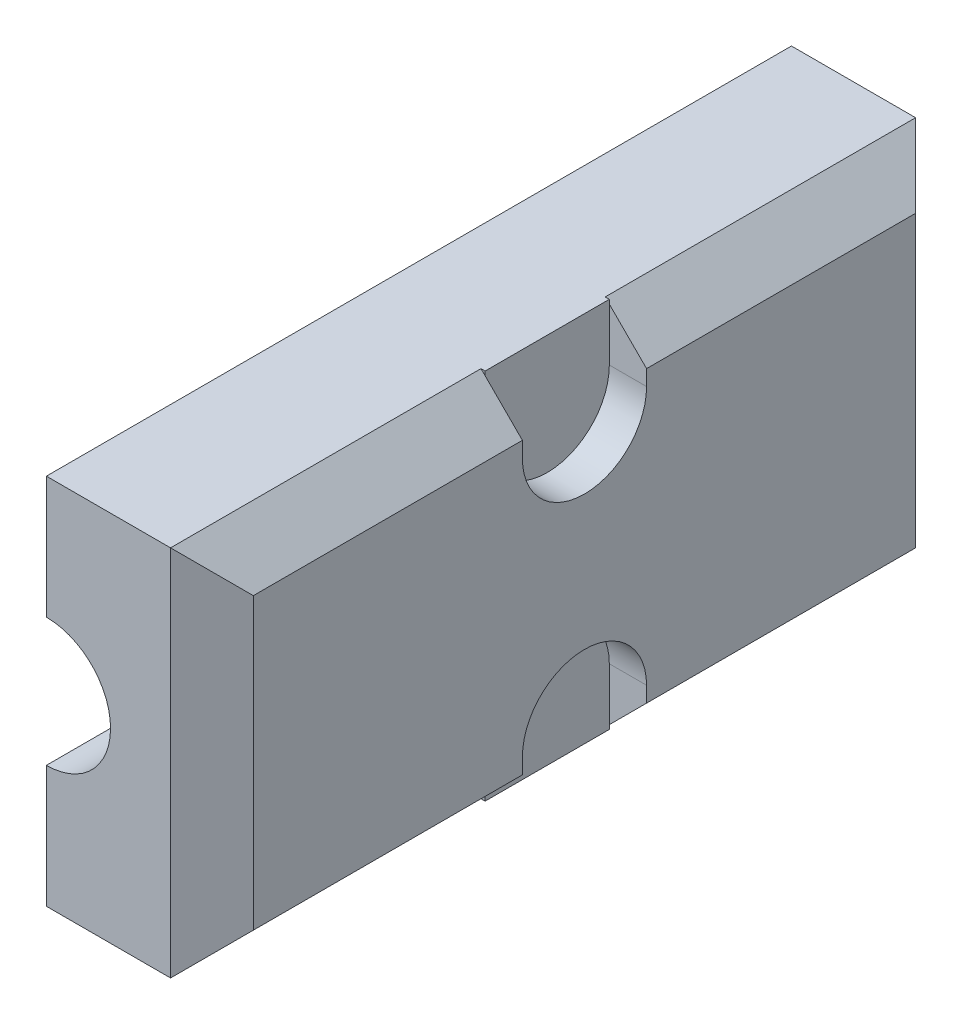
from build123d import *

# Parameters (mm, degrees)
SKETCH_1_W              = 36
SKETCH_1_H              = 18
EXTRUDE_1_DEPTH         = 8
CUT_EXTRUDE_1_DEPTH     = 38.960505792
CHAMFER_1_SIZE          = 2
CUT_EXTRUDE_2_DEPTH     = 22.656407828
CUT_EXTRUDE_START       = -2
CUT_EXTRUDE_3_OUTLINE_R = 2
CUT_EXTRUDE_3_DEPTH     = 2
EXTRUDE_2_DEPTH         = 0.2
EXTRUDE_3_DEPTH         = 3
SKETCH_7_W              = 6
SKETCH_7_H              = 6.2
CUT_EXTRUDE_4_DEPTH     = 0.5
CHAMFER_16_SIZE         = 0.5
CUT_EXTRUDE_5_REACH     = 28.683


# Read off the part's stored shape, not the designer's step: Вырез-Вытянуть3
with BuildPart() as part:
    # Эскиз1 → Бобышка-Вытянуть1 (new body)
    with BuildSketch(Plane(origin=(0, 0, 0), x_dir=(0, 0, -1), z_dir=(1, 0, 0))):
        Rectangle(SKETCH_1_W, SKETCH_1_H)
    extrude(amount=EXTRUDE_1_DEPTH)

    # Эскиз2 → Вырез-Вытянуть1 (cut, through all)
    with BuildSketch(Plane.XY.offset(18)):
        with BuildLine():
            ThreePointArc((0, -3.1), (3.1, 0), (0, 3.1))
            Line((0, 3.1), (0, -3.1))
        make_face()
    extrude(amount=-CUT_EXTRUDE_1_DEPTH, mode=Mode.SUBTRACT)

    # Фаска1
    chamfer_1_edges = [part.edges().sort_by_distance(p)[0] for p in [
        (8, 0, 18),
        (8, -9, 0),
        (8, 0, -18),
        (8, 9, 0),
    ]]
    chamfer(chamfer_1_edges, length=CHAMFER_1_SIZE)

    # Эскиз3 → Вырез-Вытянуть2 (cut, through all)
    with BuildSketch(Plane(origin=(8, 0, 0), x_dir=(0, 0, -1), z_dir=(1, 0, 0))):
        with BuildLine():
            ThreePointArc((1.413329403, 7), (1.552631161, 6.636440782), (1.6, 6.25))
            ThreePointArc((1.6, 6.25), (-0.386440782, 4.697368839), (-1.413329403, 7))
            Line((-1.413329403, 7), (-1.854049622, 7))
            ThreePointArc((-1.854049622, 7), (-0.382034525, 4.286826645), (2, 6.25))
            ThreePointArc((2, 6.25), (1.963173355, 6.632034525), (1.854049622, 7))
            Line((1.854049622, 7), (1.413329403, 7))
        make_face()
        with BuildLine():
            ThreePointArc((-1.413329403, 7), (0, 7.85), (1.413329403, 7))
            Line((1.413329403, 7), (1.854049622, 7))
            ThreePointArc((1.854049622, 7), (0, 8.25), (-1.854049622, 7))
            Line((-1.854049622, 7), (-1.413329403, 7))
        make_face()
        with BuildLine():
            ThreePointArc((-1.413329403, 7), (-0.386440782, 4.697368839), (1.6, 6.25))
            ThreePointArc((1.6, 6.25), (1.552631161, 6.636440782), (1.413329403, 7))
            Line((1.413329403, 7), (-1.413329403, 7))
        make_face()
        with BuildLine():
            Line((-1.413329403, 7), (1.413329403, 7))
            ThreePointArc((1.413329403, 7), (0, 7.85), (-1.413329403, 7))
        make_face()
        with BuildLine():
            ThreePointArc((-1.413329403, -7), (-0.386440782, -4.697368839), (1.6, -6.25))
            ThreePointArc((1.6, -6.25), (1.552631161, -6.636440782), (1.413329403, -7))
            Line((1.413329403, -7), (1.854049622, -7))
            ThreePointArc((1.854049622, -7), (1.963173355, -6.632034525), (2, -6.25))
            ThreePointArc((2, -6.25), (-0.382034525, -4.286826645), (-1.854049622, -7))
            Line((-1.854049622, -7), (-1.413329403, -7))
        make_face()
        with BuildLine():
            ThreePointArc((1.413329403, -7), (0, -7.85), (-1.413329403, -7))
            Line((-1.413329403, -7), (-1.854049622, -7))
            ThreePointArc((-1.854049622, -7), (0, -8.25), (1.854049622, -7))
            Line((1.854049622, -7), (1.413329403, -7))
        make_face()
        with BuildLine():
            ThreePointArc((1.413329403, -7), (1.552631161, -6.636440782), (1.6, -6.25))
            ThreePointArc((1.6, -6.25), (-0.386440782, -4.697368839), (-1.413329403, -7))
            Line((-1.413329403, -7), (1.413329403, -7))
        make_face()
        with BuildLine():
            Line((1.413329403, -7), (-1.413329403, -7))
            ThreePointArc((-1.413329403, -7), (0, -7.85), (1.413329403, -7))
        make_face()
    extrude(amount=-CUT_EXTRUDE_2_DEPTH, mode=Mode.SUBTRACT)

    # Вырез-Вытянуть3 outline → Вырез-Вытянуть3 (cut)
    # profile 1 of 2: a face of its own
    with BuildSketch(Plane(origin=(8, 0, 0), x_dir=(0, 0, -1), z_dir=(1, 0, 0)).offset(CUT_EXTRUDE_START)):
        with BuildLine():
            Line((-3, 9), (-3, 6.25))
            ThreePointArc((-3, 6.25), (0, 3.25), (3, 6.25))
            Line((3, 6.25), (3, 9))
            Line((3, 9), (-3, 9))
        make_face()
        with Locations((0, 6.25)):
            Circle(CUT_EXTRUDE_3_OUTLINE_R, mode=Mode.SUBTRACT)
    # profile 2 of 2: a face of its own
    with BuildSketch(Plane(origin=(8, 0, 0), x_dir=(0, 0, -1), z_dir=(1, 0, 0)).offset(CUT_EXTRUDE_START)):
        with BuildLine():
            Line((3, -9), (3, -6.25))
            ThreePointArc((3, -6.25), (0, -3.25), (-3, -6.25))
            Line((-3, -6.25), (-3, -9))
            Line((-3, -9), (3, -9))
        make_face()
        with Locations((0, -6.25)):
            Circle(CUT_EXTRUDE_3_OUTLINE_R, mode=Mode.SUBTRACT)
    extrude(amount=CUT_EXTRUDE_3_DEPTH, mode=Mode.SUBTRACT)

    # Эскиз5 → Бобышка-Вытянуть2 (add)
    with BuildSketch(Plane(origin=(6, 0, 0), x_dir=(0, 0, -1), z_dir=(1, 0, 0))):
        with BuildLine():
            Line((3, 9), (-3, 9))
            Line((-3, 9), (-3, 6.25))
            ThreePointArc((-3, 6.25), (0, 3.25), (3, 6.25))
            Line((3, 6.25), (3, 9))
        make_face()
        with BuildLine():
            Line((-3, -9), (3, -9))
            Line((3, -9), (3, -6.25))
            ThreePointArc((3, -6.25), (0, -3.25), (-3, -6.25))
            Line((-3, -6.25), (-3, -9))
        make_face()
    extrude(amount=EXTRUDE_2_DEPTH)

    # Эскиз6 → Бобышка-Вытянуть3 (add, symmetric)
    with BuildSketch(Plane.XY):
        with BuildLine():
            Line((0, 3.1), (0, -3.1))
            ThreePointArc((0, -3.1), (3.1, 0), (0, 3.1))
        make_face()
    extrude(amount=EXTRUDE_3_DEPTH, both=True)

    # Эскиз7 → Вырез-Вытянуть4 (cut, symmetric)
    with BuildSketch(Plane.ZY):
        Rectangle(SKETCH_7_W, SKETCH_7_H)
    extrude(amount=CUT_EXTRUDE_4_DEPTH, both=True, mode=Mode.SUBTRACT)

    # Фаска16
    # the kernel refuses this chamfer: 0.5 mm, written as the material it adds along each edge
    with BuildSketch(Plane(origin=(0.5, 3.1, 3), x_dir=(-0.9996219169112968, 0.027495876610586494, 0), z_dir=(0, 0, -1))) as chamfer_16_piece_1_section:
        Polygon((CHAMFER_16_SIZE * 0.999621916911, -CHAMFER_16_SIZE * 0.0274958766106), (-CHAMFER_16_SIZE * 0.0274958766106, -CHAMFER_16_SIZE * 0.999621916911), (0, 0), align=None)
    chamfer_16_piece_1 = extrude(amount=6, mode=Mode.PRIVATE)
    chamfer_16_piece_1 = split(chamfer_16_piece_1, bisect_by=Plane(origin=(0, 2.934797923, 0), z_dir=(1, 0, 0)), keep=Keep.TOP, mode=Mode.PRIVATE)
    add(chamfer_16_piece_1)
    with BuildSketch(Plane(origin=(0.5, -3.1, -3), x_dir=(-0.9996219169112968, -0.027495876610586494, 0), z_dir=(0, 0, 1))) as chamfer_16_piece_2_section:
        Polygon((CHAMFER_16_SIZE * 0.999621916911, -CHAMFER_16_SIZE * 0.0274958766106), (-CHAMFER_16_SIZE * 0.0274958766106, -CHAMFER_16_SIZE * 0.999621916911), (0, 0), align=None)
    chamfer_16_piece_2 = extrude(amount=6, mode=Mode.PRIVATE)
    chamfer_16_piece_2 = split(chamfer_16_piece_2, bisect_by=Plane(origin=(0, -2.934797923, 0), z_dir=(1, 0, 0)), keep=Keep.TOP, mode=Mode.PRIVATE)
    add(chamfer_16_piece_2)

    # Вырез-Вытянуть5: up to this plane
    cut_extrude_5_end = Plane(origin=(0.5, -2.6, 0), z_dir=(0.7071067811865525, -0.7071067811865426, 0))
    # Эскиз8 → Вырез-Вытянуть5 (cut, up to the surface)
    with BuildSketch(Plane.XZ.offset(9), mode=Mode.PRIVATE) as cut_extrude_5_sk1:
        with BuildLine():
            ThreePointArc((3.5, 6.75), (2.474873734, 9.224873734), (0, 10.25))
            Line((0, 10.25), (0, 3.25))
            ThreePointArc((0, 3.25), (2.474873734, 4.275126266), (3.5, 6.75))
        make_face()
    cut_extrude_5_tool1 = split(extrude(cut_extrude_5_sk1.sketch, amount=-CUT_EXTRUDE_5_REACH, mode=Mode.PRIVATE), bisect_by=cut_extrude_5_end, keep=Keep.BOTH, mode=Mode.PRIVATE)
    add(cut_extrude_5_tool1.solids().sort_by_distance((1.485446, -9, 6.75))[0], mode=Mode.SUBTRACT)
    # Эскиз8 → Вырез-Вытянуть5 (cut, up to the surface)
    with BuildSketch(Plane.XZ.offset(9), mode=Mode.PRIVATE) as cut_extrude_5_sk2:
        with BuildLine():
            Line((0, 3.25), (0, 10.25))
            ThreePointArc((0, 10.25), (-3.5, 6.75), (0, 3.25))
        make_face()
    cut_extrude_5_tool2 = split(extrude(cut_extrude_5_sk2.sketch, amount=-CUT_EXTRUDE_5_REACH, mode=Mode.PRIVATE), bisect_by=cut_extrude_5_end, keep=Keep.BOTH, mode=Mode.PRIVATE)
    add(cut_extrude_5_tool2.solids().sort_by_distance((-1.485446, -9, 6.75))[0], mode=Mode.SUBTRACT)
    # Эскиз8 → Вырез-Вытянуть5 (cut, up to the surface)
    with BuildSketch(Plane.XZ.offset(9), mode=Mode.PRIVATE) as cut_extrude_5_sk3:
        with BuildLine():
            ThreePointArc((3.5, -6.75), (2.474873734, -4.275126266), (0, -3.25))
            Line((0, -3.25), (0, -10.25))
            ThreePointArc((0, -10.25), (2.474873734, -9.224873734), (3.5, -6.75))
        make_face()
    cut_extrude_5_tool3 = split(extrude(cut_extrude_5_sk3.sketch, amount=-CUT_EXTRUDE_5_REACH, mode=Mode.PRIVATE), bisect_by=cut_extrude_5_end, keep=Keep.BOTH, mode=Mode.PRIVATE)
    add(cut_extrude_5_tool3.solids().sort_by_distance((1.485446, -9, -6.75))[0], mode=Mode.SUBTRACT)
    # Эскиз8 → Вырез-Вытянуть5 (cut, up to the surface)
    with BuildSketch(Plane.XZ.offset(9), mode=Mode.PRIVATE) as cut_extrude_5_sk4:
        with BuildLine():
            Line((0, -10.25), (0, -3.25))
            ThreePointArc((0, -3.25), (-3.5, -6.75), (0, -10.25))
        make_face()
    cut_extrude_5_tool4 = split(extrude(cut_extrude_5_sk4.sketch, amount=-CUT_EXTRUDE_5_REACH, mode=Mode.PRIVATE), bisect_by=cut_extrude_5_end, keep=Keep.BOTH, mode=Mode.PRIVATE)
    add(cut_extrude_5_tool4.solids().sort_by_distance((-1.485446, -9, -6.75))[0], mode=Mode.SUBTRACT)


solid = part.part
